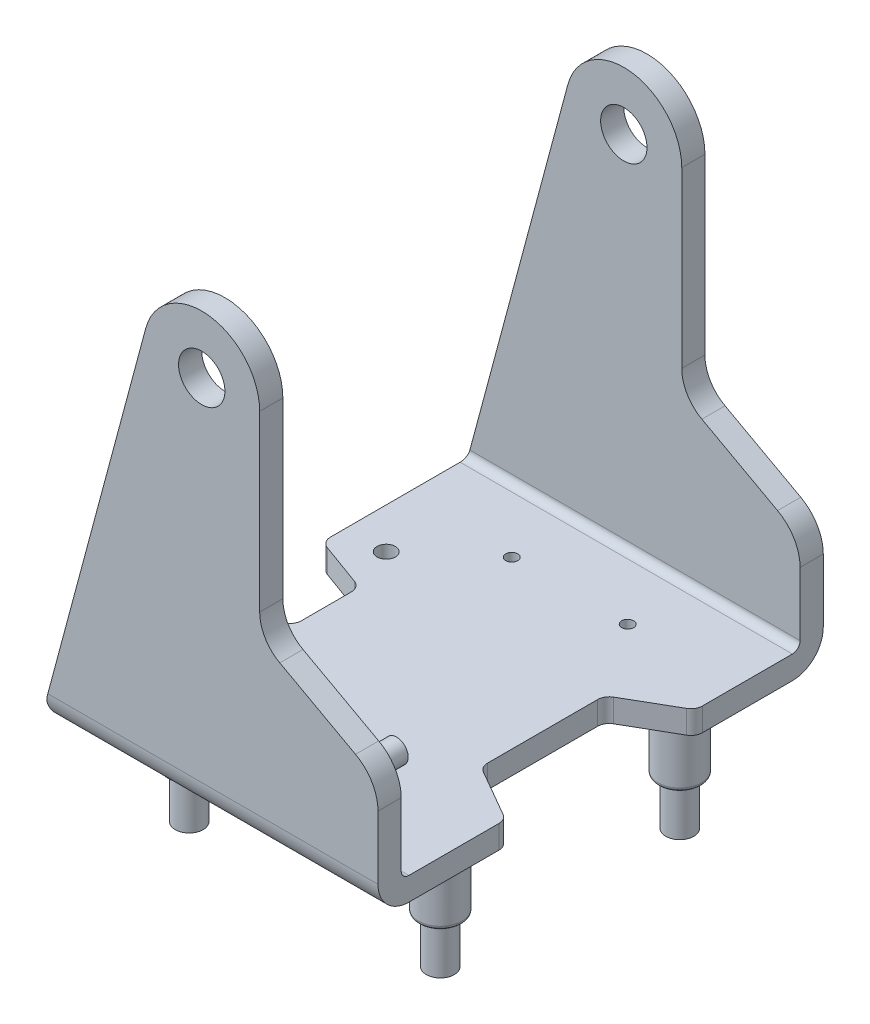
from build123d import *

# Parameters (mm, degrees)
SKETCH1_R               = 3.625
BOSS_EXTRUDE1_DEPTH     = 29
BOSS_EXTRUDE1_2_DEPTH   = 29
BOSS_EXTRUDE1_3_DEPTH   = 29
BOSS_EXTRUDE1_4_DEPTH   = 29
SKETCH2_W               = 86
SKETCH2_H               = 115.25
BOSS_EXTRUDE2_DEPTH     = 6
BOSS_EXTRUDE3_DEPTH     = 6
FILLET2_R               = 10
FILLET2_OF_MIRROR1_R    = 10
SKETCH5_R               = 5.625
SKETCH5_R_2             = 3.625
BOSS_EXTRUDE4_DEPTH     = 17
FILLET3_R               = 2
FILLET4_R               = 1
FILLET5_R               = 8
FILLET6_R               = 2
CUT_EXTRUDE1_DEPTH      = 130.503469817
FILLET7_R               = 3
CUT_EXTRUDE2_DEPTH      = 168.515951876
CUT_EXTRUDE2_DEPTH_BACK = 168.515951876
SKETCH7_R               = 6
SKETCH9_R               = 3
BOSS_EXTRUDE6_DEPTH     = 10
SKETCH8_R               = 3
BOSS_EXTRUDE7_DEPTH     = 10
FILLET8_R               = 2
CUT_EXTRUDE3_DEPTH      = 135.535022422
CUT_EXTRUDE3_DEPTH_BACK = 135.535022422
SKETCH12_R              = 1.55
BOSS_EXTRUDE8_DEPTH     = 6
CUT_EXTRUDE4_DEPTH      = 10
FILLET9_R               = 3
SKETCH15_R              = 2.375
CUT_EXTRUDE5_DEPTH      = 10
CUT_EXTRUDE6_DEPTH      = 164.445997605
CUT_EXTRUDE6_DEPTH_BACK = 164.445997605


with BuildPart() as part:
    # Sketch1 → Boss-Extrude1 (new body)
    with BuildSketch(Plane(origin=(0, 0, 0), x_dir=(1, 0, 0), z_dir=(0, 1, 0))):
        with Locations(Location((-32.5, 31, 0), (0, 0, 270))):
            Circle(SKETCH1_R)
    extrude(amount=-BOSS_EXTRUDE1_DEPTH)



with BuildPart() as body_2:
    # Sketch1 → Boss-Extrude1 2 (new body)
    with BuildSketch(Plane(origin=(0, 0, 0), x_dir=(1, 0, 0), z_dir=(0, 1, 0))):
        with Locations(Location((-32.5, -31, 0), (0, 0, 270))):
            Circle(SKETCH1_R)
    extrude(amount=-BOSS_EXTRUDE1_2_DEPTH)


with BuildPart() as body_3:
    # Sketch1 → Boss-Extrude1 3 (new body)
    with BuildSketch(Plane(origin=(0, 0, 0), x_dir=(1, 0, 0), z_dir=(0, 1, 0))):
        with Locations(Location((32.5, -31, 0), (0, 0, 270))):
            Circle(SKETCH1_R)
    extrude(amount=-BOSS_EXTRUDE1_3_DEPTH)


with BuildPart() as body_4:
    # Sketch1 → Boss-Extrude1 4 (new body)
    with BuildSketch(Plane(origin=(0, 0, 0), x_dir=(1, 0, 0), z_dir=(0, 1, 0))):
        with Locations(Location((32.5, 31, 0), (0, 0, 270))):
            Circle(SKETCH1_R)
    extrude(amount=-BOSS_EXTRUDE1_4_DEPTH)


with BuildPart() as part_1:
    add(part.part)

    add(body_2.part)  # Boss-Extrude2 merges body 2

    add(body_3.part)  # Boss-Extrude2 merges body 3

    add(body_4.part)  # Boss-Extrude2 merges body 4
    # Sketch2 → Boss-Extrude2 (add)
    with BuildSketch(Plane(origin=(0, 0, 0), x_dir=(1, 0, 0), z_dir=(0, 1, 0))):
        Rectangle(SKETCH2_W, SKETCH2_H)
    extrude(amount=BOSS_EXTRUDE2_DEPTH)

    # Sketch4 → Boss-Extrude3 (add)
    with BuildSketch(Plane.XY.offset(57.625)):
        with BuildLine():
            Line((43, 6), (-43, 6))
            Line((-43, 6), (-17.11809549, 102.592582629))
            ThreePointArc((-17.11809549, 102.592582629), (-0.671315212, 113.581969873), (12.370791905, 98.710296952))
            Line((12.370791905, 98.710296952), (12.370791905, 53.710296952))
            ThreePointArc((12.370791905, 53.710296952), (15.299724093, 46.639229141), (22.370791905, 43.710296952))
            Line((22.370791905, 43.710296952), (43, 43.710296952))
            Line((43, 43.710296952), (43, 6))
        make_face()
    boss_extrude3 = extrude(amount=-BOSS_EXTRUDE3_DEPTH)

    # Fillet2
    fillet2_edges = [part_1.edges().sort_by_distance(p)[0] for p in [
        (43, 43.710296952, 54.625),
    ]]
    fillet(fillet2_edges, radius=FILLET2_R)

    # Mirror1: Boss-Extrude3 across plane
    add(boss_extrude3.mirror(Plane.XY))

    # Fillet2 of Mirror1
    fillet2_of_mirror1_edges = [part_1.edges().sort_by_distance(p)[0] for p in [
        (43, 43.710296952, -54.625),
    ]]
    fillet(fillet2_of_mirror1_edges, radius=FILLET2_OF_MIRROR1_R)

    # Sketch5 → Boss-Extrude4 (add)
    # profile 1 of 4: a face of its own
    with BuildSketch(Plane.XZ):
        with Locations(Location((-32.5, 31, 0), (0, 0, 90))):
            Circle(SKETCH5_R)
        with Locations(Location((-32.5, 31, 0), (0, 0, 90))):
            Circle(SKETCH5_R_2, mode=Mode.SUBTRACT)
    # profile 2 of 4: a face of its own
    with BuildSketch(Plane.XZ):
        with Locations(Location((32.5, 31, 0), (0, 0, 90))):
            Circle(SKETCH5_R)
        with Locations(Location((32.5, 31, 0), (0, 0, 90))):
            Circle(SKETCH5_R_2, mode=Mode.SUBTRACT)
    # profile 3 of 4: a face of its own
    with BuildSketch(Plane.XZ):
        with Locations(Location((32.5, -31, 0), (0, 0, 90))):
            Circle(SKETCH5_R)
        with Locations(Location((32.5, -31, 0), (0, 0, 90))):
            Circle(SKETCH5_R_2, mode=Mode.SUBTRACT)
    # profile 4 of 4: a face of its own
    with BuildSketch(Plane.XZ):
        with Locations(Location((-32.5, -31, 0), (0, 0, 90))):
            Circle(SKETCH5_R)
        with Locations(Location((-32.5, -31, 0), (0, 0, 90))):
            Circle(SKETCH5_R_2, mode=Mode.SUBTRACT)
    extrude(amount=BOSS_EXTRUDE4_DEPTH)

    # Fillet3
    fillet3_edges = [part_1.edges().sort_by_distance(p)[0] for p in [
        (-32.5, 0, 25.375),
        (32.5, 0, 25.375),
        (32.5, 0, -36.625),
        (-32.5, 0, -36.625),
    ]]
    fillet(fillet3_edges, radius=FILLET3_R)

    # Fillet4
    fillet4_edges = [part_1.edges().sort_by_distance(p)[0] for p in [
        (-32.5, -17, 27.375),
        (-32.5, -17, 25.375),
        (32.5, -17, 27.375),
        (32.5, -17, 25.375),
        (32.5, -17, -34.625),
        (32.5, -17, -36.625),
        (-32.5, -17, -34.625),
        (-32.5, -17, -36.625),
    ]]
    fillet(fillet4_edges, radius=FILLET4_R - 0.0001)  # a hair under: the kernel refuses the full size

    # Fillet5
    fillet5_edges = [part_1.edges().sort_by_distance(p)[0] for p in [
        (0, 0, -57.625),
        (0, 0, 57.625),
    ]]
    fillet(fillet5_edges, radius=FILLET5_R)

    # Fillet6
    fillet6_edges = [part_1.edges().sort_by_distance(p)[0] for p in [
        (0, 6, 51.625),
        (0, 6, -51.625),
    ]]
    fillet(fillet6_edges, radius=FILLET6_R)

    # Sketch6 → Cut-Extrude1 (cut, symmetric)
    with BuildSketch(Plane(origin=(0, 6, 0), x_dir=(1, 0, 0), z_dir=(0, 1, 0))):
        Polygon((-43, 24.625), (-28, 15.964745962), (-28, -15.964745962), (-43, -24.625), align=None)
    cut_extrude1 = extrude(amount=CUT_EXTRUDE1_DEPTH, both=True, mode=Mode.SUBTRACT)

    # Mirror2: Cut-Extrude1 across plane
    add(cut_extrude1.mirror(Plane(origin=(0, 0, 0), x_dir=(0, 0, 1), z_dir=(1, 0, 0))), mode=Mode.SUBTRACT)

    # Fillet7
    fillet7_edges = [part_1.edges().sort_by_distance(p)[0] for p in [
        (-43, 3, 24.625),
        (-43, 3, -24.625),
        (-28, 3, -15.964745962),
        (-28, 3, 15.964745962),
        (43, 3, -24.625),
        (43, 3, 24.625),
        (28, 3, 15.964745962),
        (28, 3, -15.964745962),
    ]]
    fillet(fillet7_edges, radius=FILLET7_R)

    # Sketch7 → Cut-Extrude2 (cut, two sides: drawn at the far end of the back side and taken through both)
    with BuildSketch(Plane.XY.offset(57.625).offset(-CUT_EXTRUDE2_DEPTH_BACK)):
        with Locations((-2.629208095, 98.710296952)):
            Circle(SKETCH7_R)
    extrude(amount=CUT_EXTRUDE2_DEPTH + CUT_EXTRUDE2_DEPTH_BACK, mode=Mode.SUBTRACT)

    # Sketch9 → Boss-Extrude6 (add)
    with BuildSketch(Plane(origin=(0, 0, 51.625), x_dir=(-1, 0, 0), z_dir=(0, 0, -1))):
        with Locations((21.2278168, 17.436820688)):
            Circle(SKETCH9_R)
    extrude(amount=BOSS_EXTRUDE6_DEPTH)

    # Sketch8 → Boss-Extrude7 (add)
    with BuildSketch(Plane(origin=(0, 0, 51.625), x_dir=(-1, 0, 0), z_dir=(0, 0, -1))):
        with Locations((-31.817877634, 24.420418847)):
            Circle(SKETCH8_R)
    extrude(amount=BOSS_EXTRUDE7_DEPTH)

    # Fillet8
    fillet8_edges = [part_1.edges().sort_by_distance(p)[0] for p in [
        (-18.2278168, 17.436820688, 51.625),
        (34.817877634, 24.420418847, 51.625),
    ]]
    fillet(fillet8_edges, radius=FILLET8_R)

    # Sketch12 → Cut-Extrude3 (cut, two sides: drawn at the far end of the back side and taken through both)
    with BuildSketch(Plane.XZ.offset(-CUT_EXTRUDE3_DEPTH_BACK)):
        with Locations(Location((-15, 35, 0), (0, 0, 90))):
            Circle(SKETCH12_R)
        with Locations(Location((15, 35, 0), (0, 0, 90))):
            Circle(SKETCH12_R)
        with Locations(Location((15, -35, 0), (0, 0, 90))):
            Circle(SKETCH12_R)
        with Locations(Location((-15, -35, 0), (0, 0, 90))):
            Circle(SKETCH12_R)
    extrude(amount=CUT_EXTRUDE3_DEPTH + CUT_EXTRUDE3_DEPTH_BACK, mode=Mode.SUBTRACT)

    # Sketch13 → Boss-Extrude8 (add)
    with BuildSketch(Plane(origin=(0, 6, 0), x_dir=(1, 0, 0), z_dir=(0, 1, 0))):
        with BuildLine():
            Line((-41.5, -23.758974596), (-29.5, -16.830771366))
            ThreePointArc((-29.5, -16.830771366), (-28.401923789, -15.732695155), (-28, -14.232695155))
            Line((-28, -14.232695155), (-28, 14.232695155))
            ThreePointArc((-28, 14.232695155), (-28.401923789, 15.732695155), (-29.5, 16.830771366))
            Line((-29.5, 16.830771366), (-41.5, 23.758974596))
            ThreePointArc((-41.5, 23.758974596), (-42.598076211, 24.857050808), (-43, 26.357050808))
            Line((-43, 26.357050808), (-43, -26.357050808))
            ThreePointArc((-43, -26.357050808), (-42.598076211, -24.857050808), (-41.5, -23.758974596))
        make_face()
    extrude(amount=-BOSS_EXTRUDE8_DEPTH)

    # Sketch14 → Cut-Extrude4 (cut)
    with BuildSketch(Plane(origin=(0, 6, 0), x_dir=(1, 0, 0), z_dir=(0, 1, 0))):
        Polygon((-43, 14), (-43, -14), (-28, -8.540446486), (-28, 8.540446486), align=None)
    extrude(amount=-CUT_EXTRUDE4_DEPTH, mode=Mode.SUBTRACT)

    # Fillet9
    fillet9_edges = [part_1.edges().sort_by_distance(p)[0] for p in [
        (-43, 3, 14),
        (-43, 3, -14),
        (-28, 3, -8.540446486),
        (-28, 3, 8.540446486),
    ]]
    fillet(fillet9_edges, radius=FILLET9_R)

    # Sketch15 → Cut-Extrude5 (cut)
    with BuildSketch(Plane(origin=(0, 6, 0), x_dir=(1, 0, 0), z_dir=(0, 1, 0))):
        with Locations(Location((-32.5, 20, 0), (0, 0, 270))):
            Circle(SKETCH15_R)
        with Locations(Location((-32.5, -20, 0), (0, 0, 270))):
            Circle(SKETCH15_R)
    extrude(amount=-CUT_EXTRUDE5_DEPTH, mode=Mode.SUBTRACT)

    # Sketch16 → Cut-Extrude6 (cut, two sides: drawn at the far end of the back side and taken through both)
    with BuildSketch(Plane(origin=(0, 0, 51.625), x_dir=(-1, 0, 0), z_dir=(0, 0, -1)).offset(-CUT_EXTRUDE6_DEPTH_BACK)):
        with BuildLine():
            Line((-47.739415262, 24.420418847), (-43, 24.420418847))
            Line((-43, 24.420418847), (-43, 33.710296952))
            ThreePointArc((-43, 33.710296952), (-40.071067812, 40.781364764), (-33, 43.710296952))
            Line((-33, 43.710296952), (-47.739415262, 43.710296952))
            Line((-47.739415262, 43.710296952), (-47.739415262, 24.420418847))
        make_face()
        with BuildLine():
            Line((-37.175791591, 34.235337015), (-17.579291882, 44.932966633))
            ThreePointArc((-17.579291882, 44.932966633), (-19.898273269, 44.020784498), (-22.370791905, 43.710296952))
            Line((-22.370791905, 43.710296952), (-33, 43.710296952))
            ThreePointArc((-33, 43.710296952), (-40.071067812, 40.781364764), (-43, 33.710296952))
            Line((-43, 33.710296952), (-43, 24.420418847))
            ThreePointArc((-43, 24.420418847), (-41.434340344, 30.12686306), (-37.175791591, 34.235337015))
        make_face()
    extrude(amount=CUT_EXTRUDE6_DEPTH + CUT_EXTRUDE6_DEPTH_BACK, mode=Mode.SUBTRACT)


solid = part_1.part
